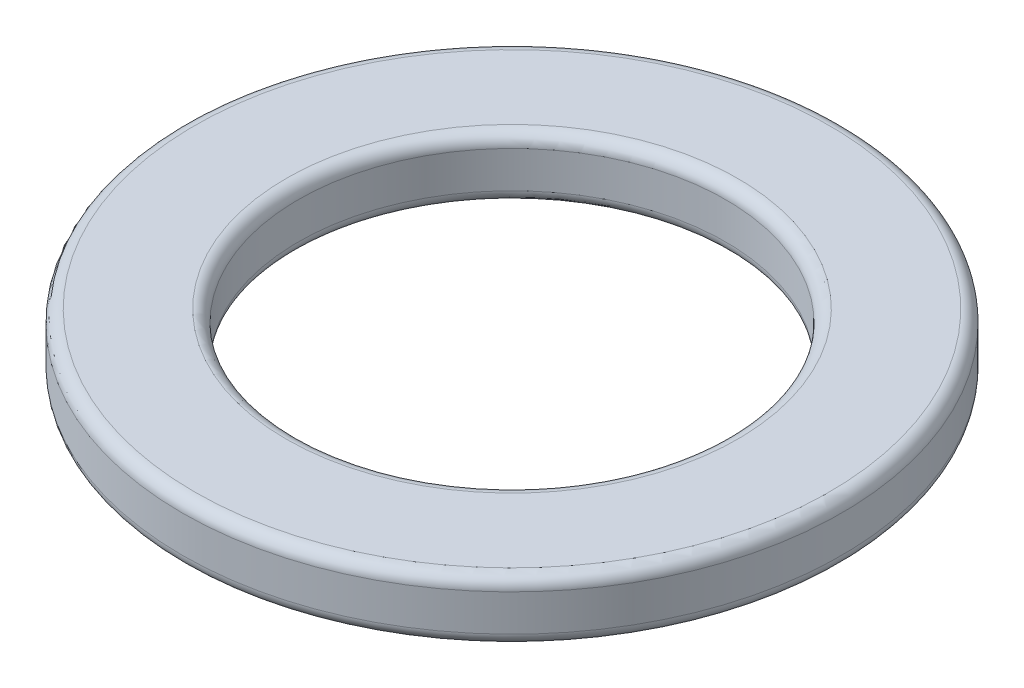
from build123d import *

# Parameters (mm, degrees)
SKETCH1_R           = 5.4
SKETCH1_R_2         = 3.5
BOSS_EXTRUDE1_DEPTH = 1
FILLET1_R           = 0.2


with BuildPart() as part:
    # Sketch1 → Boss-Extrude1 (new body)
    with BuildSketch(Plane(origin=(0, 0, 0), x_dir=(1, 0, 0), z_dir=(0, 1, 0))):
        Circle(SKETCH1_R)
        Circle(SKETCH1_R_2, mode=Mode.SUBTRACT)
    extrude(amount=BOSS_EXTRUDE1_DEPTH)

    # Fillet1
    fillet1_edges = [part.edges().sort_by_distance(p)[0] for p in [
        (-3.5, 0, 0),
        (-3.5, 1, 0),
        (-5.4, 0, 0),
        (-5.4, 1, 0),
    ]]
    fillet(fillet1_edges, radius=FILLET1_R)


solid = part.part
